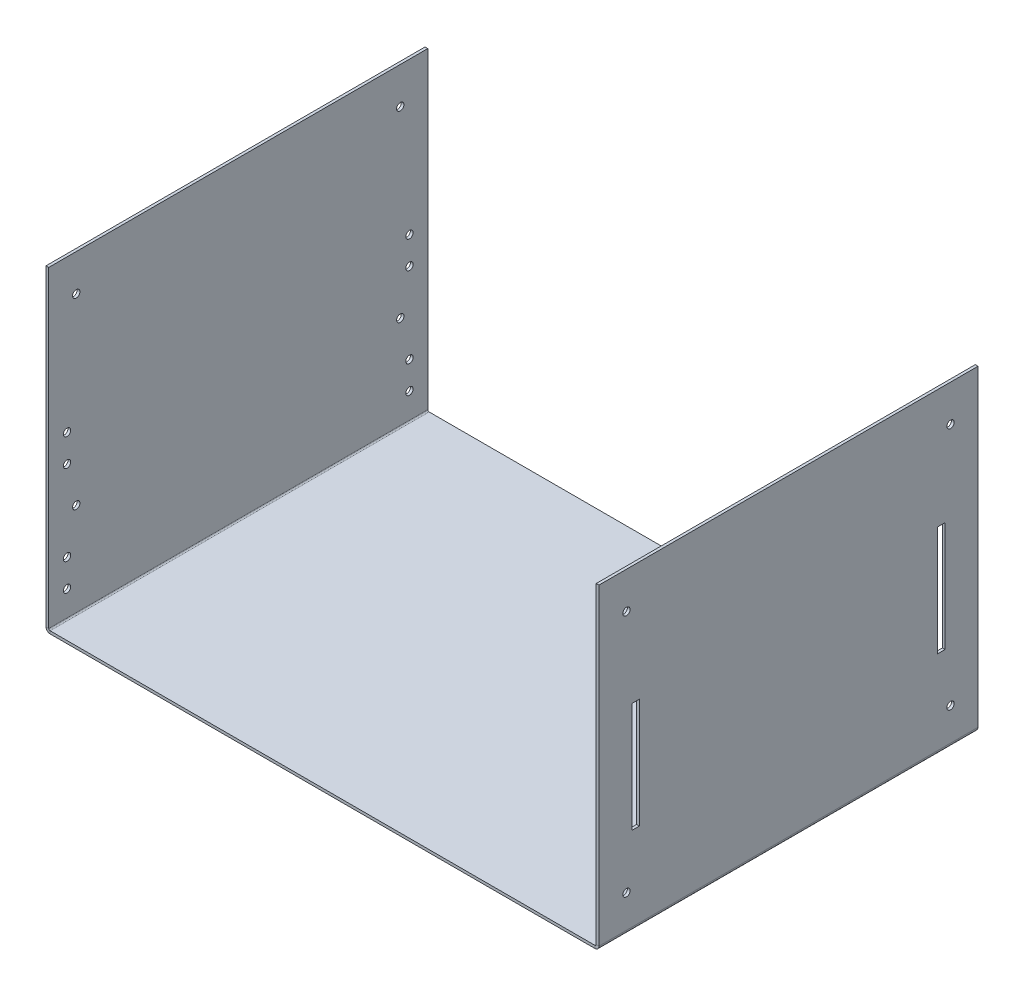
from build123d import *

# Parameters (mm, degrees)
SKETCH_1_W                         = 302
SKETCH_1_H                         = 207
SM_BASE_FLANGE_1_DEPTH             = 1.5
SM_EDGE_FLANGE_1_STRIP_W           = 7.4732
SM_EDGE_FLANGE_1_STRIP_H           = 1.5
SM_EDGE_FLANGE_1_STRIP_CUT_DEPTH   = 207
SM_EDGE_FLANGE_1_STRIP_2_W         = 7.4732
SM_EDGE_FLANGE_1_STRIP_2_H         = 1.5
SM_EDGE_FLANGE_1_STRIP_CUT_2_DEPTH = 207
SM_EDGE_FLANGE_1_DEPTH             = 207
SM_EDGE_FLANGE_1_BEND_DEPTH        = 207
CUT_EXTRUDE_1_REACH                = 406.308
SKETCH_12_W                        = 4
SKETCH_12_H                        = 60
CUT_EXTRUDE_2_REACH                = 406.308
SKETCH_13_R                        = 2
CUT_EXTRUDE_3_REACH                = 406.308
SKETCH_14_R                        = 2
CUT_EXTRUDE_4_REACH                = 406.308
SKETCH_15_R                        = 2


# Sheet-metal steps are written as plain solids
with BuildPart() as part:
    # Sketch 1 → Базовая кромка1 (new body)
    with BuildSketch(Plane(origin=(0, 0, 0), x_dir=(1, 0, 0), z_dir=(0, 1, 0))):
        with Locations((151, 103.5)):
            Rectangle(SKETCH_1_W, SKETCH_1_H)
    extrude(amount=-SM_BASE_FLANGE_1_DEPTH)

    # Ребро-кромка1 strip (across the edge) → Ребро-кромка1 strip cut (cut)
    with BuildSketch(Plane.XY.offset(-207)):
        with Locations((-1.5, -0.75)):
            Rectangle(SM_EDGE_FLANGE_1_STRIP_W, SM_EDGE_FLANGE_1_STRIP_H)
    extrude(amount=SM_EDGE_FLANGE_1_STRIP_CUT_DEPTH, mode=Mode.SUBTRACT)

    # Ребро-кромка1 strip 2 (across the edge) → Ребро-кромка1 strip cut 2 (cut)
    with BuildSketch(Plane(origin=(302, 0, 0), x_dir=(-1, 0, 0), z_dir=(0, 0, -1))):
        with Locations((-1.5, -0.75)):
            Rectangle(SM_EDGE_FLANGE_1_STRIP_2_W, SM_EDGE_FLANGE_1_STRIP_2_H)
    extrude(amount=SM_EDGE_FLANGE_1_STRIP_CUT_2_DEPTH, mode=Mode.SUBTRACT)

    # Ребро-кромка1 section (across the edge) → Ребро-кромка1 (add)
    with BuildSketch(Plane.XY.offset(-207)):
        with BuildLine():
            Line((0, 0.7366), (0, 171.5))
            Line((0, 171.5), (1.5, 171.5))
            Line((1.5, 171.5), (1.5, 0.7366))
            ThreePointArc((1.5, 0.7366), (1.715745145, 0.215745145), (2.2366, 0))
            Line((2.2366, 0), (2.2366, -1.5))
            ThreePointArc((2.2366, -1.5), (0.655084973, -0.844915027), (0, 0.7366))
        make_face()
    extrude(amount=SM_EDGE_FLANGE_1_DEPTH)

    # Ребро-кромка1 section 2 (across the edge) → Ребро-кромка1 bend (add)
    with BuildSketch(Plane(origin=(302, 0, 0), x_dir=(-1, 0, 0), z_dir=(0, 0, -1))):
        with BuildLine():
            Line((0, 0.7366), (0, 171.5))
            Line((0, 171.5), (1.5, 171.5))
            Line((1.5, 171.5), (1.5, 0.7366))
            ThreePointArc((1.5, 0.7366), (1.715745145, 0.215745145), (2.2366, 0))
            Line((2.2366, 0), (2.2366, -1.5))
            ThreePointArc((2.2366, -1.5), (0.655084973, -0.844915027), (0, 0.7366))
        make_face()
    extrude(amount=SM_EDGE_FLANGE_1_BEND_DEPTH)

    # Эскиз12 → Вырез-Вытянуть1 (cut, up to next)
    with BuildSketch(Plane(origin=(302, 0, 0), x_dir=(0, 0, -1), z_dir=(1, 0, 0)), mode=Mode.PRIVATE) as cut_extrude_1_sk1:
        with Locations((187, 76.5)):
            Rectangle(SKETCH_12_W, SKETCH_12_H)
    cut_extrude_1_tool1 = extrude(cut_extrude_1_sk1.sketch, amount=-CUT_EXTRUDE_1_REACH, mode=Mode.PRIVATE) & part.part
    # Эскиз12 → Вырез-Вытянуть1 (cut, up to next)
    with BuildSketch(Plane(origin=(302, 0, 0), x_dir=(0, 0, -1), z_dir=(1, 0, 0)), mode=Mode.PRIVATE) as cut_extrude_1_sk2:
        with Locations((20, 76.5)):
            Rectangle(SKETCH_12_W, SKETCH_12_H)
    cut_extrude_1_tool2 = extrude(cut_extrude_1_sk2.sketch, amount=-CUT_EXTRUDE_1_REACH, mode=Mode.PRIVATE) & part.part
    add(cut_extrude_1_tool1.solids().sort_by_distance((302, 76.5, -187))[0], mode=Mode.SUBTRACT)
    add(cut_extrude_1_tool2.solids().sort_by_distance((302, 76.5, -20))[0], mode=Mode.SUBTRACT)

    # Эскиз13 → Вырез-Вытянуть2 (cut, up to next)
    with BuildSketch(Plane.ZY, mode=Mode.PRIVATE) as cut_extrude_2_sk1:
        with Locations(Location((-197, 88.5, 0), (0, 0, 270))):
            Circle(SKETCH_13_R)
    cut_extrude_2_tool1 = extrude(cut_extrude_2_sk1.sketch, amount=-CUT_EXTRUDE_2_REACH, mode=Mode.PRIVATE) & part.part
    # Эскиз13 → Вырез-Вытянуть2 (cut, up to next)
    with BuildSketch(Plane.ZY, mode=Mode.PRIVATE) as cut_extrude_2_sk2:
        with Locations(Location((-197, 73.5, 0), (0, 0, 270))):
            Circle(SKETCH_13_R)
    cut_extrude_2_tool2 = extrude(cut_extrude_2_sk2.sketch, amount=-CUT_EXTRUDE_2_REACH, mode=Mode.PRIVATE) & part.part
    # Эскиз13 → Вырез-Вытянуть2 (cut, up to next)
    with BuildSketch(Plane.ZY, mode=Mode.PRIVATE) as cut_extrude_2_sk3:
        with Locations(Location((-197, 29.5, 0), (0, 0, 270))):
            Circle(SKETCH_13_R)
    cut_extrude_2_tool3 = extrude(cut_extrude_2_sk3.sketch, amount=-CUT_EXTRUDE_2_REACH, mode=Mode.PRIVATE) & part.part
    # Эскиз13 → Вырез-Вытянуть2 (cut, up to next)
    with BuildSketch(Plane.ZY, mode=Mode.PRIVATE) as cut_extrude_2_sk4:
        with Locations(Location((-197, 14.5, 0), (0, 0, 270))):
            Circle(SKETCH_13_R)
    cut_extrude_2_tool4 = extrude(cut_extrude_2_sk4.sketch, amount=-CUT_EXTRUDE_2_REACH, mode=Mode.PRIVATE) & part.part
    # Эскиз13 → Вырез-Вытянуть2 (cut, up to next)
    with BuildSketch(Plane.ZY, mode=Mode.PRIVATE) as cut_extrude_2_sk5:
        with Locations(Location((-10, 14.5, 0), (0, 0, 270))):
            Circle(SKETCH_13_R)
    cut_extrude_2_tool5 = extrude(cut_extrude_2_sk5.sketch, amount=-CUT_EXTRUDE_2_REACH, mode=Mode.PRIVATE) & part.part
    # Эскиз13 → Вырез-Вытянуть2 (cut, up to next)
    with BuildSketch(Plane.ZY, mode=Mode.PRIVATE) as cut_extrude_2_sk6:
        with Locations(Location((-10, 29.5, 0), (0, 0, 270))):
            Circle(SKETCH_13_R)
    cut_extrude_2_tool6 = extrude(cut_extrude_2_sk6.sketch, amount=-CUT_EXTRUDE_2_REACH, mode=Mode.PRIVATE) & part.part
    # Эскиз13 → Вырез-Вытянуть2 (cut, up to next)
    with BuildSketch(Plane.ZY, mode=Mode.PRIVATE) as cut_extrude_2_sk7:
        with Locations(Location((-10, 73.5, 0), (0, 0, 270))):
            Circle(SKETCH_13_R)
    cut_extrude_2_tool7 = extrude(cut_extrude_2_sk7.sketch, amount=-CUT_EXTRUDE_2_REACH, mode=Mode.PRIVATE) & part.part
    # Эскиз13 → Вырез-Вытянуть2 (cut, up to next)
    with BuildSketch(Plane.ZY, mode=Mode.PRIVATE) as cut_extrude_2_sk8:
        with Locations(Location((-10, 88.5, 0), (0, 0, 270))):
            Circle(SKETCH_13_R)
    cut_extrude_2_tool8 = extrude(cut_extrude_2_sk8.sketch, amount=-CUT_EXTRUDE_2_REACH, mode=Mode.PRIVATE) & part.part
    add(cut_extrude_2_tool1.solids().sort_by_distance((0, 88.5, -197))[0], mode=Mode.SUBTRACT)
    add(cut_extrude_2_tool2.solids().sort_by_distance((0, 73.5, -197))[0], mode=Mode.SUBTRACT)
    add(cut_extrude_2_tool3.solids().sort_by_distance((0, 29.5, -197))[0], mode=Mode.SUBTRACT)
    add(cut_extrude_2_tool4.solids().sort_by_distance((0, 14.5, -197))[0], mode=Mode.SUBTRACT)
    add(cut_extrude_2_tool5.solids().sort_by_distance((0, 14.5, -10))[0], mode=Mode.SUBTRACT)
    add(cut_extrude_2_tool6.solids().sort_by_distance((0, 29.5, -10))[0], mode=Mode.SUBTRACT)
    add(cut_extrude_2_tool7.solids().sort_by_distance((0, 73.5, -10))[0], mode=Mode.SUBTRACT)
    add(cut_extrude_2_tool8.solids().sort_by_distance((0, 88.5, -10))[0], mode=Mode.SUBTRACT)

    # Эскиз14 → Вырез-Вытянуть3 (cut, up to next)
    with BuildSketch(Plane.ZY, mode=Mode.PRIVATE) as cut_extrude_3_sk1:
        with Locations(Location((-192, 151.5, 0), (0, 0, 270))):
            Circle(SKETCH_14_R)
    cut_extrude_3_tool1 = extrude(cut_extrude_3_sk1.sketch, amount=-CUT_EXTRUDE_3_REACH, mode=Mode.PRIVATE) & part.part
    # Эскиз14 → Вырез-Вытянуть3 (cut, up to next)
    with BuildSketch(Plane.ZY, mode=Mode.PRIVATE) as cut_extrude_3_sk2:
        with Locations(Location((-15, 151.5, 0), (0, 0, 270))):
            Circle(SKETCH_14_R)
    cut_extrude_3_tool2 = extrude(cut_extrude_3_sk2.sketch, amount=-CUT_EXTRUDE_3_REACH, mode=Mode.PRIVATE) & part.part
    # Эскиз14 → Вырез-Вытянуть3 (cut, up to next)
    with BuildSketch(Plane.ZY, mode=Mode.PRIVATE) as cut_extrude_3_sk3:
        with Locations(Location((-15, 51.5, 0), (0, 0, 270))):
            Circle(SKETCH_14_R)
    cut_extrude_3_tool3 = extrude(cut_extrude_3_sk3.sketch, amount=-CUT_EXTRUDE_3_REACH, mode=Mode.PRIVATE) & part.part
    # Эскиз14 → Вырез-Вытянуть3 (cut, up to next)
    with BuildSketch(Plane.ZY, mode=Mode.PRIVATE) as cut_extrude_3_sk4:
        with Locations(Location((-192, 51.5, 0), (0, 0, 270))):
            Circle(SKETCH_14_R)
    cut_extrude_3_tool4 = extrude(cut_extrude_3_sk4.sketch, amount=-CUT_EXTRUDE_3_REACH, mode=Mode.PRIVATE) & part.part
    add(cut_extrude_3_tool1.solids().sort_by_distance((0, 151.5, -192))[0], mode=Mode.SUBTRACT)
    add(cut_extrude_3_tool2.solids().sort_by_distance((0, 151.5, -15))[0], mode=Mode.SUBTRACT)
    add(cut_extrude_3_tool3.solids().sort_by_distance((0, 51.5, -15))[0], mode=Mode.SUBTRACT)
    add(cut_extrude_3_tool4.solids().sort_by_distance((0, 51.5, -192))[0], mode=Mode.SUBTRACT)

    # Эскиз15 → Вырез-Вытянуть4 (cut, up to next)
    with BuildSketch(Plane(origin=(302, 0, 0), x_dir=(0, 0, -1), z_dir=(1, 0, 0)), mode=Mode.PRIVATE) as cut_extrude_4_sk1:
        with Locations(Location((15, 151.5, 0), (0, 0, 270))):
            Circle(SKETCH_15_R)
    cut_extrude_4_tool1 = extrude(cut_extrude_4_sk1.sketch, amount=-CUT_EXTRUDE_4_REACH, mode=Mode.PRIVATE) & part.part
    # Эскиз15 → Вырез-Вытянуть4 (cut, up to next)
    with BuildSketch(Plane(origin=(302, 0, 0), x_dir=(0, 0, -1), z_dir=(1, 0, 0)), mode=Mode.PRIVATE) as cut_extrude_4_sk2:
        with Locations(Location((192, 151.5, 0), (0, 0, 270))):
            Circle(SKETCH_15_R)
    cut_extrude_4_tool2 = extrude(cut_extrude_4_sk2.sketch, amount=-CUT_EXTRUDE_4_REACH, mode=Mode.PRIVATE) & part.part
    # Эскиз15 → Вырез-Вытянуть4 (cut, up to next)
    with BuildSketch(Plane(origin=(302, 0, 0), x_dir=(0, 0, -1), z_dir=(1, 0, 0)), mode=Mode.PRIVATE) as cut_extrude_4_sk3:
        with Locations(Location((15, 18.5, 0), (0, 0, 90))):
            Circle(SKETCH_15_R)
    cut_extrude_4_tool3 = extrude(cut_extrude_4_sk3.sketch, amount=-CUT_EXTRUDE_4_REACH, mode=Mode.PRIVATE) & part.part
    # Эскиз15 → Вырез-Вытянуть4 (cut, up to next)
    with BuildSketch(Plane(origin=(302, 0, 0), x_dir=(0, 0, -1), z_dir=(1, 0, 0)), mode=Mode.PRIVATE) as cut_extrude_4_sk4:
        with Locations(Location((192, 18.5, 0), (0, 0, 90))):
            Circle(SKETCH_15_R)
    cut_extrude_4_tool4 = extrude(cut_extrude_4_sk4.sketch, amount=-CUT_EXTRUDE_4_REACH, mode=Mode.PRIVATE) & part.part
    add(cut_extrude_4_tool1.solids().sort_by_distance((302, 151.5, -15))[0], mode=Mode.SUBTRACT)
    add(cut_extrude_4_tool2.solids().sort_by_distance((302, 151.5, -192))[0], mode=Mode.SUBTRACT)
    add(cut_extrude_4_tool3.solids().sort_by_distance((302, 18.5, -15))[0], mode=Mode.SUBTRACT)
    add(cut_extrude_4_tool4.solids().sort_by_distance((302, 18.5, -192))[0], mode=Mode.SUBTRACT)


solid = part.part
